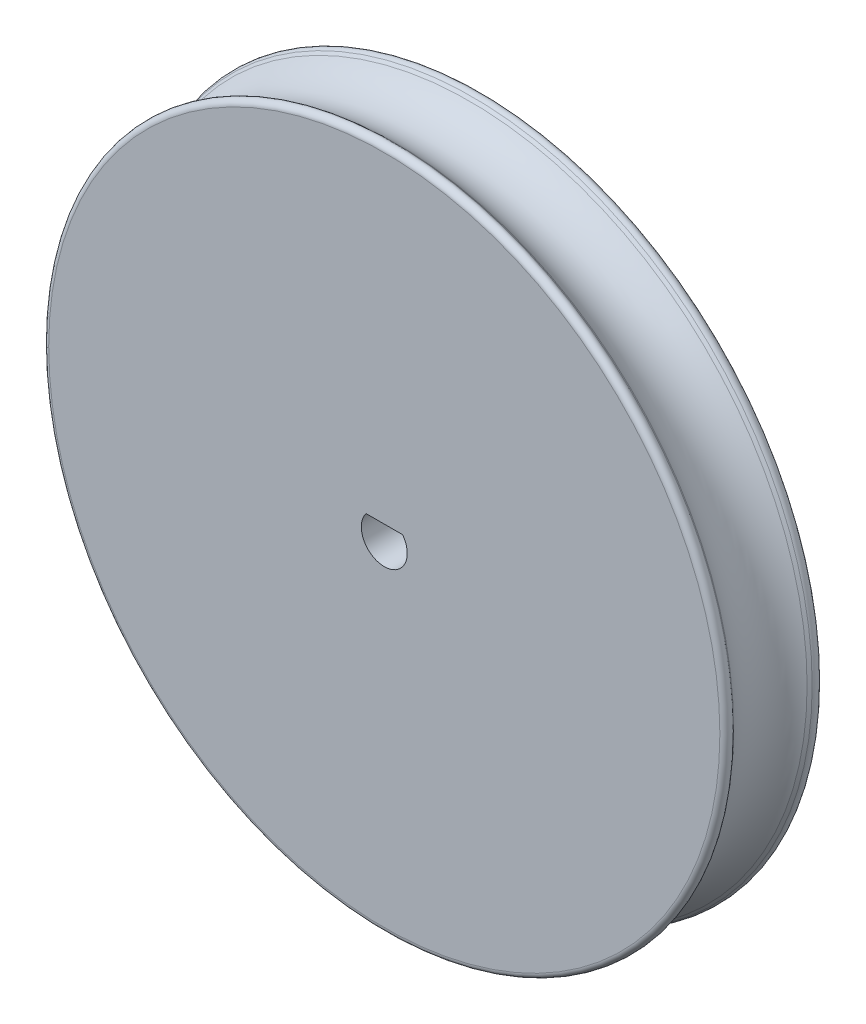
from build123d import *

# Parameters (mm, degrees)
SKETCH1_R           = 25
SKETCH1_R_2         = 1.5
BOSS_EXTRUDE1_DEPTH = 7
FILLET1_R           = 0.4
BOSS_EXTRUDE2_DEPTH = 7
MOVE_FACE1_DEPTH    = 7


# Read off the part's stored shape, not the designer's step: Move Face1
with BuildPart() as part:
    # Sketch1 → Boss-Extrude1 (new body)
    with BuildSketch(Plane.XY):
        Circle(SKETCH1_R)
        Circle(SKETCH1_R_2, mode=Mode.SUBTRACT)
    extrude(amount=BOSS_EXTRUDE1_DEPTH)

    # Sketch2 → Cut-Revolve1 (revolve, cut)
    with BuildSketch(Plane(origin=(0, 0, 0), x_dir=(0, 0, -1), z_dir=(1, 0, 0)), mode=Mode.PRIVATE) as cut_revolve1_sk:
        with BuildLine():
            Line((-7, 25), (-6.139887117, 24.237039248))
            ThreePointArc((-6.139887117, 24.237039248), (-3.5, 23.102184954), (-0.860112883, 24.237039248))
            Line((-0.860112883, 24.237039248), (0, 25))
            Line((0, 25), (-7, 25))
        make_face()
    revolve(cut_revolve1_sk.sketch.rotate(Axis((0, 0, 7), (0, 0, -1)), 90), axis=Axis((0, 0, 7), (0, 0, -1)), mode=Mode.SUBTRACT)

    # Fillet1
    fillet1_edges = [part.edges().sort_by_distance(p)[0] for p in [
        (-25, 0, 0),
        (-25, 0, 7),
    ]]
    fillet(fillet1_edges, radius=FILLET1_R)

    # Sketch3 → Boss-Extrude2 (add, through all)
    with BuildSketch(Plane.XY.offset(7)):
        with BuildLine():
            Line((-1.12, 0.997797575), (1.12, 0.997797575))
            ThreePointArc((1.12, 0.997797575), (0, 1.5), (-1.12, 0.997797575))
        make_face()
    extrude(amount=-BOSS_EXTRUDE2_DEPTH)

    # Move Face1 outline → Move Face1 (cut)
    with BuildSketch(Plane.XY):
        with BuildLine():
            ThreePointArc((-1.314115672, 0.997797575), (0, -1.65), (1.314115672, 0.997797575))
            Line((1.314115672, 0.997797575), (1.12, 0.997797575))
            ThreePointArc((1.12, 0.997797575), (0, -1.5), (-1.12, 0.997797575))
            Line((-1.12, 0.997797575), (-1.314115672, 0.997797575))
        make_face()
    extrude(amount=MOVE_FACE1_DEPTH, mode=Mode.SUBTRACT)


solid = part.part
